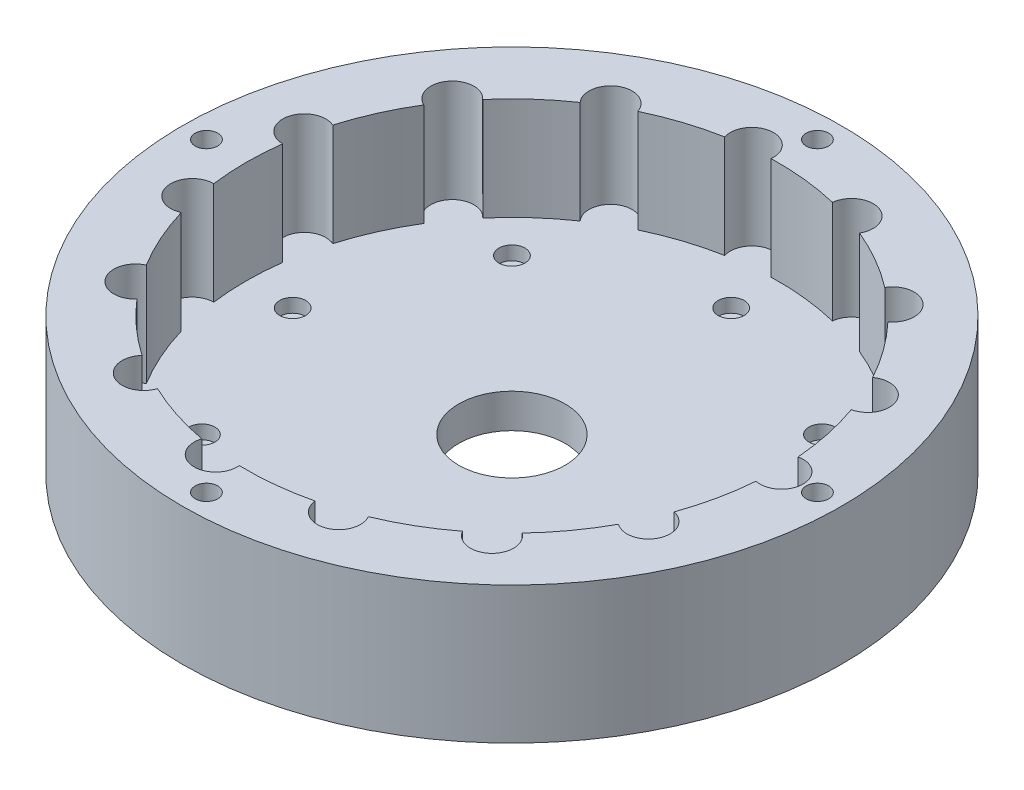
from build123d import *

# Parameters (mm, degrees)
SKETCH1_R           = 45.85
SKETCH1_R_2         = 1.5635
SKETCH1_R_3         = 7.4
BOSS_EXTRUDE1_DEPTH = 4.7625
SKETCH1_6_R         = 1.8125
CUT_EXTRUDE1_DEPTH  = 1.9125
BOSS_EXTRUDE2_START = 14.2875
SKETCH1_7_R         = 45.85
SKETCH1_7_R_2       = 1.5635
BOSS_EXTRUDE2_DEPTH = 14.2875


with BuildPart() as part:
    # Sketch1 → Boss-Extrude1 (new body)
    with BuildSketch(Plane(origin=(0, 0, 0), x_dir=(1, 0, 0), z_dir=(0, 1, 0))):
        Circle(SKETCH1_R)
        with Locations((0, -42.5)):
            Circle(SKETCH1_R_2, mode=Mode.SUBTRACT)
        with Locations((-42.5, 0)):
            Circle(SKETCH1_R_2, mode=Mode.SUBTRACT)
        with Locations((42.5, 0)):
            Circle(SKETCH1_R_2, mode=Mode.SUBTRACT)
        with Locations((0, 42.5)):
            Circle(SKETCH1_R_2, mode=Mode.SUBTRACT)
        Circle(SKETCH1_R_3, mode=Mode.SUBTRACT)
    extrude(amount=-BOSS_EXTRUDE1_DEPTH)

    # Sketch1<6> → Cut-Extrude1 (cut)
    with BuildSketch(Plane(origin=(0, 0, 0), x_dir=(1, 0, 0), z_dir=(0, 1, 0))):
        with Locations((30.5, 0)):
            Circle(SKETCH1_6_R)
        with Locations((21.566756826, -21.566756826)):
            Circle(SKETCH1_6_R)
        with Locations((0, -30.5)):
            Circle(SKETCH1_6_R)
        with Locations((-21.566756826, -21.566756826)):
            Circle(SKETCH1_6_R)
        with Locations((-30.5, 0)):
            Circle(SKETCH1_6_R)
        with Locations((-21.566756826, 21.566756826)):
            Circle(SKETCH1_6_R)
        with Locations((0, 30.5)):
            Circle(SKETCH1_6_R)
        with Locations((21.566756826, 21.566756826)):
            Circle(SKETCH1_6_R)
    extrude(amount=-CUT_EXTRUDE1_DEPTH, mode=Mode.SUBTRACT)

    # Sketch1<7> → Boss-Extrude2 (add)
    with BuildSketch(Plane(origin=(0, 0, 0), x_dir=(1, 0, 0), z_dir=(0, 1, 0)).offset(BOSS_EXTRUDE2_START)):
        Circle(SKETCH1_7_R)
        with Locations((0, -42.5)):
            Circle(SKETCH1_7_R_2, mode=Mode.SUBTRACT)
        with Locations((-42.5, 0)):
            Circle(SKETCH1_7_R_2, mode=Mode.SUBTRACT)
        with Locations((42.5, 0)):
            Circle(SKETCH1_7_R_2, mode=Mode.SUBTRACT)
        with BuildLine():
            ThreePointArc((36.883333333, 2.935936345), (39.39076704, 2.32916294), (40.5, 0))
            ThreePointArc((40.5, 0), (39.39076704, -2.32916294), (36.883333333, -2.935936345))
            ThreePointArc((36.883333333, -2.935936345), (36.191461227, -7.69273256), (34.888754523, -12.319691873))
            ThreePointArc((34.888754523, -12.319691873), (36.59166411, -13.367471546), (37.257954662, -15.252624115))
            ThreePointArc((37.257954662, -15.252624115), (35.6231437, -17.924001829), (32.500448736, -17.683914497))
            ThreePointArc((32.500448736, -17.683914497), (29.933628792, -21.748054335), (26.861593101, -25.445133446))
            ThreePointArc((26.861593101, -25.445133446), (27.767055295, -26.50917897), (28.092397738, -27.867930955))
            ThreePointArc((28.092397738, -27.867930955), (25.872343464, -30.764771418), (22.497941295, -29.37418318))
            ThreePointArc((22.497941295, -29.37418318), (18.5, -32.04293994), (14.189818202, -34.170880284))
            ThreePointArc((14.189818202, -34.170880284), (14.486847583, -34.891651942), (14.588137289, -35.664619361))
            ThreePointArc((14.588137289, -35.664619361), (11.748752331, -38.660316744), (8.605335417, -35.985388734))
            ThreePointArc((8.605335417, -35.985388734), (3.867553141, -36.797310129), (-0.935505175, -36.988171489))
            ThreePointArc((-0.935505175, -36.988171489), (-0.92374189, -37.141170608), (-0.919817373, -37.294571076))
            ThreePointArc((-0.919817373, -37.294571076), (-4.385552663, -40.258199029), (-6.775211132, -36.37439366))
            ThreePointArc((-6.775211132, -36.37439366), (-11.433628792, -35.189091103), (-15.899071208, -33.409871815))
            ThreePointArc((-15.899071208, -33.409871815), (-20.25, -35.074028853), (-20.984262125, -30.47393547))
            ThreePointArc((-20.984262125, -30.47393547), (-24.757832435, -27.496358543), (-28.113543391, -24.054701786))
            ThreePointArc((-28.113543391, -24.054701786), (-32.765188272, -23.805302718), (-31.564943561, -19.304256991))
            ThreePointArc((-31.564943561, -19.304256991), (-33.801181933, -15.049255794), (-35.466928517, -10.540255288))
            ThreePointArc((-35.466928517, -10.540255288), (-39.61497783, -8.420423478), (-36.687759497, -4.796697105))
            ThreePointArc((-36.687759497, -4.796697105), (-37, 0), (-36.687759497, 4.796697105))
            ThreePointArc((-36.687759497, 4.796697105), (-39.61497783, 8.420423478), (-35.466928517, 10.540255288))
            ThreePointArc((-35.466928517, 10.540255288), (-33.801181933, 15.049255794), (-31.564943561, 19.304256991))
            ThreePointArc((-31.564943561, 19.304256991), (-32.765188272, 23.805302718), (-28.113543391, 24.054701786))
            ThreePointArc((-28.113543391, 24.054701786), (-24.757832435, 27.496358543), (-20.984262125, 30.47393547))
            ThreePointArc((-20.984262125, 30.47393547), (-20.25, 35.074028853), (-15.899071208, 33.409871815))
            ThreePointArc((-15.899071208, 33.409871815), (-11.433628792, 35.189091103), (-6.775211132, 36.37439366))
            ThreePointArc((-6.775211132, 36.37439366), (-4.385552663, 40.258199029), (-0.919817373, 37.294571076))
            ThreePointArc((-0.919817373, 37.294571076), (-0.92374189, 37.141170608), (-0.935505175, 36.988171489))
            ThreePointArc((-0.935505175, 36.988171489), (3.867553141, 36.797310129), (8.605335417, 35.985388734))
            ThreePointArc((8.605335417, 35.985388734), (11.748752331, 38.660316744), (14.588137289, 35.664619361))
            ThreePointArc((14.588137289, 35.664619361), (14.486847583, 34.891651942), (14.189818202, 34.170880284))
            ThreePointArc((14.189818202, 34.170880284), (18.5, 32.04293994), (22.497941295, 29.37418318))
            ThreePointArc((22.497941295, 29.37418318), (25.872343464, 30.764771418), (28.092397738, 27.867930955))
            ThreePointArc((28.092397738, 27.867930955), (27.767055295, 26.50917897), (26.861593101, 25.445133446))
            ThreePointArc((26.861593101, 25.445133446), (29.933628792, 21.748054335), (32.500448736, 17.683914497))
            ThreePointArc((32.500448736, 17.683914497), (35.6231437, 17.924001829), (37.257954662, 15.252624115))
            ThreePointArc((37.257954662, 15.252624115), (36.59166411, 13.367471546), (34.888754523, 12.319691873))
            ThreePointArc((34.888754523, 12.319691873), (36.191461227, 7.69273256), (36.883333333, 2.935936345))
        make_face(mode=Mode.SUBTRACT)
        with Locations((0, 42.5)):
            Circle(SKETCH1_7_R_2, mode=Mode.SUBTRACT)
    extrude(amount=-BOSS_EXTRUDE2_DEPTH)


solid = part.part
